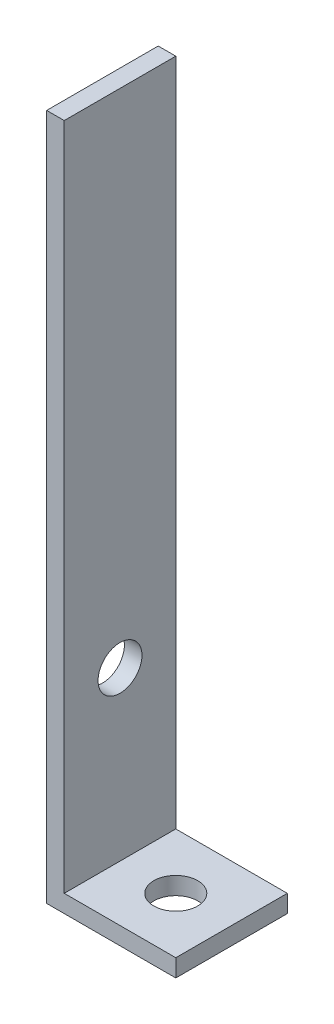
from build123d import *

# Parameters (mm, degrees)
BOSS_EXTRUDE1_DEPTH   = 12.7
F_5_0MM_DOWEL_HOLE1_D = 5
F_5_0MM_DOWEL_HOLE2_D = 5


with BuildPart() as part:
    # Sketch1 → Boss-Extrude1 (new body)
    with BuildSketch(Plane.XY):
        Polygon((0, 0), (14.7, 0), (14.7, 2), (2, 2), (2, 78.2), (0, 78.2), align=None)
    extrude(amount=BOSS_EXTRUDE1_DEPTH)

    # Ø5.0mm Dowel Hole1 (through all)
    with Locations(Plane(origin=(2, 0, 0), x_dir=(0, 0, -1), z_dir=(1, 0, 0))):
        with Locations((-6.35, 21.05)):
            Hole(F_5_0MM_DOWEL_HOLE1_D / 2)

    # Ø5.0mm Dowel Hole2 (through all)
    with Locations(Plane(origin=(0, 2, 0), x_dir=(1, 0, 0), z_dir=(0, 1, 0))):
        with Locations((8.35, -6.35)):
            Hole(F_5_0MM_DOWEL_HOLE2_D / 2)


solid = part.part
